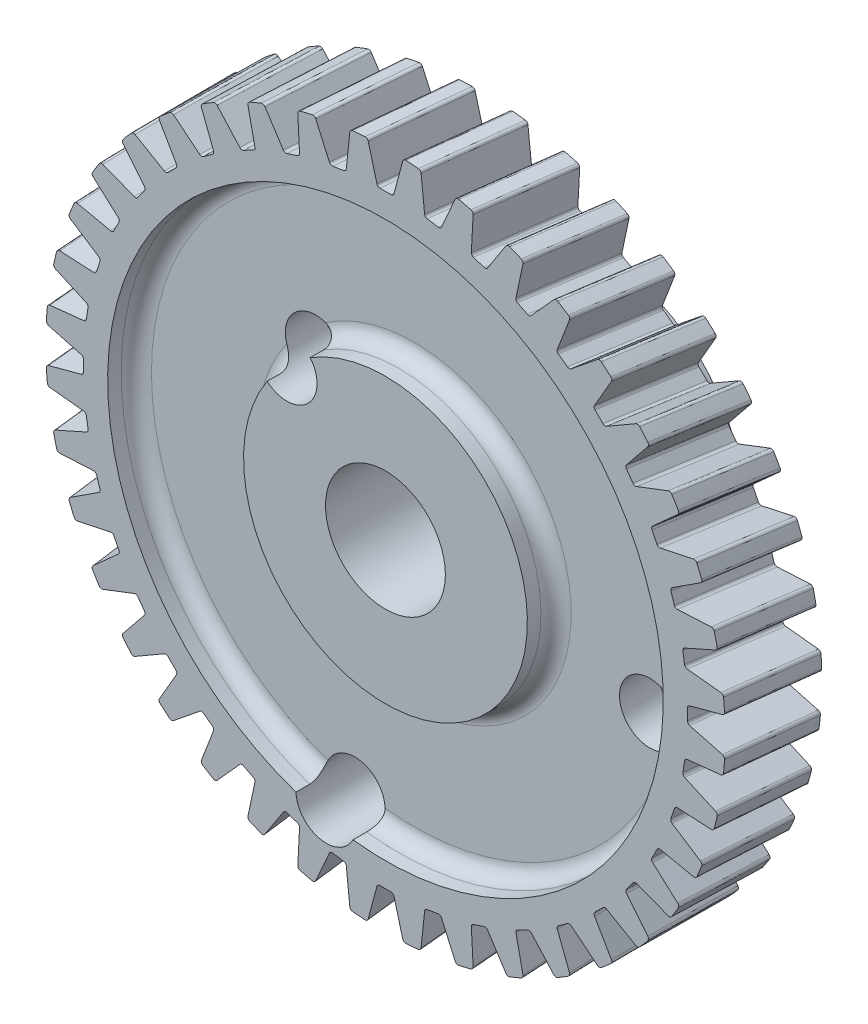
from build123d import *

# Parameters (mm, degrees)
FILLET1_R                = 1
CIRPATTERN1_COUNT        = 40
FILLET2_R                = 0.2
F_4_0_4_DIAMETER_HOLE1_D = 4


with BuildPart() as part:
    # Sketch2 → Revolve1 (revolve)
    with BuildSketch(Plane(origin=(0, 0, 0), x_dir=(0, 0, -1), z_dir=(1, 0, 0))):
        Polygon((11, 3.96875), (-3.2, 3.96875), (-3.2, 9.4), (-1.3, 9.4), (-1.3, 18.4), (-3.2, 18.4), (-3.2, 22.5), (3.2, 22.5), (3.2, 18.4), (1.3, 18.4), (1.3, 9.4), (3.2, 9.4), (11, 9.4), align=None)
    revolve(axis=Axis((0, 0, 0), (0, 0, -1)))

    # Fillet1
    fillet1_edges = [part.edges().sort_by_distance(p)[0] for p in [
        (0, -18.4, 1.3),
        (0, -9.4, 1.3),
        (0, -9.4, -1.3),
        (0, -18.4, -1.3),
    ]]
    fillet(fillet1_edges, radius=FILLET1_R)

    # Cut-Sweep1: sweep along a path in Sketch4
    with BuildLine(Plane(origin=(0, 0, 0), x_dir=(1, 0, 0), z_dir=(0, 1, 0))) as cut_sweep1_path:
        Line((0, -3.2), (0.690971205, 3.2))
    # Sketch3 → Cut-Sweep1 (sweep, cut)
    with BuildSketch(Plane.XY.offset(3.2)):
        Polygon((-0.525, 20), (0.525, 20), (1.246362285, 22.6921607), (-1.246362285, 22.6921607), align=None)
    cut_sweep1 = sweep(path=cut_sweep1_path.line, mode=Mode.SUBTRACT)

    # CirPattern1: Cut-Sweep1 ×40 about axis
    cirpattern1_axis = Axis((0, 0, 3.2), (0, 0, 1))
    for i in range(1, CIRPATTERN1_COUNT):
        add(cut_sweep1.rotate(cirpattern1_axis, i * 360 / CIRPATTERN1_COUNT), mode=Mode.SUBTRACT)

    # Fillet2
    fillet2_edges = [part.edges().sort_by_distance(p)[0] for p in [
        (1.526462518, 22.448160552, 5.3054e-05),
        (0.870485603, 20, 0),
        (-0.845126217, 22.484122435, -6.2808e-05),
        (-2.003996756, 22.410577793, 5.3054e-05),
        (-2.26892082, 19.889940761, 0),
        (-3.305993578, 19.725684573, 0),
        (-4.352012976, 22.07509871, -6.2808e-05),
        (-5.485110979, 21.821172231, 5.3054e-05),
        (-5.352458883, 19.29012517, 0),
        (-6.351068225, 18.965657326, 0),
        (-7.751738732, 21.122512792, -6.2808e-05),
        (-8.831163565, 20.694456989, 5.3054e-05),
        (-8.304201644, 18.215322678, 0),
        (-9.239758494, 17.738632653, 0),
        (-10.960590953, 19.649820507, -6.2808e-05),
        (-11.959763596, 19.058175535, 5.3054e-05),
        (-11.0514674, 16.691998487, 0),
        (-11.900935244, 16.074823972, 0),
        (-13.89955705, 17.693284427, -6.2808e-05),
        (-14.793874554, 16.952618549, 5.3054e-05),
        (-13.526609351, 14.757661896, 0),
        (-14.269071471, 14.015199776, 0),
        (-16.496269922, 15.301080964, -6.2808e-05),
        (-17.263711223, 14.429631832, 5.3054e-05),
        (-15.668681288, 12.459942692, 0),
        (-16.285855803, 11.610474848, 0),
        (-18.68678988, 12.532114106, -6.2808e-05),
        (-19.308458027, 11.55133969, 5.3054e-05),
        (-17.42493829, 9.855418346, 0),
        (-17.901628315, 8.919861496, 0),
        (-20.417179054, 9.454565008, -6.2808e-05),
        (-20.877766513, 8.388615227, 5.3054e-05),
        (-18.752135481, 7.008220892, 0),
        (-19.076603325, 6.00961155, 0),
        (-21.644829518, 6.144213141, -6.2808e-05),
        (-21.932995098, 5.019335218, 5.3054e-05),
        (-19.617592862, 3.988457781, 0),
        (-19.781849051, 2.951385024, 0),
        (-22.339512445, 2.682570354, -6.2808e-05),
        (-22.448160552, 1.526462518, 5.3054e-05),
        (-20, 0.870485603, 0),
        (-20, -0.179514397, 0),
        (-22.484122435, -0.845126217, -6.2808e-05),
        (-22.410577793, -2.003996756, 5.3054e-05),
        (-19.889940761, -2.26892082, 0),
        (-19.725684573, -3.305993578, 0),
        (-22.07509871, -4.352012976, -6.2808e-05),
        (-21.821172231, -5.485110979, 5.3054e-05),
        (-19.29012517, -5.352458883, 0),
        (-18.965657326, -6.351068225, 0),
        (-21.122512792, -7.751738732, -6.2808e-05),
        (-20.694456989, -8.831163565, 5.3054e-05),
        (-18.215322678, -8.304201644, 0),
        (-17.738632653, -9.239758494, 0),
        (-19.649820507, -10.960590953, -6.2808e-05),
        (-19.058175535, -11.959763596, 5.3054e-05),
        (-16.691998487, -11.0514674, 0),
        (-16.074823972, -11.900935244, 0),
        (-17.693284427, -13.89955705, -6.2808e-05),
        (-16.952618549, -14.793874554, 5.3054e-05),
        (-14.757661896, -13.526609351, 0),
        (-14.015199776, -14.269071471, 0),
        (-15.301080964, -16.496269922, -6.2808e-05),
        (-14.429631832, -17.263711223, 5.3054e-05),
        (-12.459942692, -15.668681288, 0),
        (-11.610474848, -16.285855803, 0),
        (-12.532114106, -18.68678988, -6.2808e-05),
        (-11.55133969, -19.308458027, 5.3054e-05),
        (-9.855418346, -17.42493829, 0),
        (-8.919861496, -17.901628315, 0),
        (-9.454565008, -20.417179054, -6.2808e-05),
        (-8.388615227, -20.877766513, 5.3054e-05),
        (-7.008220892, -18.752135481, 0),
        (-6.00961155, -19.076603325, 0),
        (-6.144213141, -21.644829518, -6.2808e-05),
        (-5.019335218, -21.932995098, 5.3054e-05),
        (-3.988457781, -19.617592862, 0),
        (-2.951385024, -19.781849051, 0),
        (-2.682570354, -22.339512445, -6.2808e-05),
        (-1.526462518, -22.448160552, 5.3054e-05),
        (-0.870485603, -20, 0),
        (0.179514397, -20, 0),
        (0.845126217, -22.484122435, -6.2808e-05),
        (2.003996756, -22.410577793, 5.3054e-05),
        (2.26892082, -19.889940761, 0),
        (3.305993578, -19.725684573, 0),
        (4.352012976, -22.07509871, -6.2808e-05),
        (5.485110979, -21.821172231, 5.3054e-05),
        (5.352458883, -19.29012517, 0),
        (6.351068225, -18.965657326, 0),
        (7.751738732, -21.122512792, -6.2808e-05),
        (8.831163565, -20.694456989, 5.3054e-05),
        (8.304201644, -18.215322678, 0),
        (9.239758494, -17.738632653, 0),
        (10.960590953, -19.649820507, -6.2808e-05),
        (11.959763596, -19.058175535, 5.3054e-05),
        (11.0514674, -16.691998487, 0),
        (11.900935244, -16.074823972, 0),
        (13.89955705, -17.693284427, -6.2808e-05),
        (14.793874554, -16.952618549, 5.3054e-05),
        (13.526609351, -14.757661896, 0),
        (14.269071471, -14.015199776, 0),
        (16.496269922, -15.301080964, -6.2808e-05),
        (17.263711223, -14.429631832, 5.3054e-05),
        (15.668681288, -12.459942692, 0),
        (16.285855803, -11.610474848, 0),
        (18.68678988, -12.532114106, -6.2808e-05),
        (19.308458027, -11.55133969, 5.3054e-05),
        (17.42493829, -9.855418346, 0),
        (17.901628315, -8.919861496, 0),
        (20.417179054, -9.454565008, -6.2808e-05),
        (20.877766513, -8.388615227, 5.3054e-05),
        (18.752135481, -7.008220892, 0),
        (19.076603325, -6.00961155, 0),
        (21.644829518, -6.144213141, -6.2808e-05),
        (21.932995098, -5.019335218, 5.3054e-05),
        (19.617592862, -3.988457781, 0),
        (19.781849051, -2.951385024, 0),
        (22.339512445, -2.682570354, -6.2808e-05),
        (22.448160552, -1.526462518, 5.3054e-05),
        (20, -0.870485603, 0),
        (20, 0.179514397, 0),
        (22.484122435, 0.845126217, -6.2808e-05),
        (22.410577793, 2.003996756, 5.3054e-05),
        (19.889940761, 2.26892082, 0),
        (19.725684573, 3.305993578, 0),
        (22.07509871, 4.352012976, -6.2808e-05),
        (21.821172231, 5.485110979, 5.3054e-05),
        (19.29012517, 5.352458883, 0),
        (18.965657326, 6.351068225, 0),
        (21.122512792, 7.751738732, -6.2808e-05),
        (20.694456989, 8.831163565, 5.3054e-05),
        (18.215322678, 8.304201644, 0),
        (17.738632653, 9.239758494, 0),
        (19.649820507, 10.960590953, -6.2808e-05),
        (19.058175535, 11.959763596, 5.3054e-05),
        (16.691998487, 11.0514674, 0),
        (16.074823972, 11.900935244, 0),
        (17.693284427, 13.89955705, -6.2808e-05),
        (16.952618549, 14.793874554, 5.3054e-05),
        (14.757661896, 13.526609351, 0),
        (14.015199776, 14.269071471, 0),
        (15.301080964, 16.496269922, -6.2808e-05),
        (14.429631832, 17.263711223, 5.3054e-05),
        (12.459942692, 15.668681288, 0),
        (11.610474848, 16.285855803, 0),
        (12.532114106, 18.68678988, -6.2808e-05),
        (11.55133969, 19.308458027, 5.3054e-05),
        (9.855418346, 17.42493829, 0),
        (8.919861496, 17.901628315, 0),
        (9.454565008, 20.417179054, -6.2808e-05),
        (8.388615227, 20.877766513, 5.3054e-05),
        (7.008220892, 18.752135481, 0),
        (6.00961155, 19.076603325, 0),
        (6.144213141, 21.644829518, -6.2808e-05),
        (5.019335218, 21.932995098, 5.3054e-05),
        (3.988457781, 19.617592862, 0),
        (2.951385024, 19.781849051, 0),
        (2.682570354, 22.339512445, -6.2808e-05),
        (-0.179514397, 20, 0),
    ]]
    fillet(fillet2_edges, radius=FILLET2_R)

    # Ø4.0 (4) Diameter Hole1 (through all)
    with Locations(Plane(origin=(66.617802584, -178.239954308, 3.9366), x_dir=(0.9999854958897523, -0.005385908477352911, 0), z_dir=(0, 0, 1))):
        with Locations((-74.142612517, 184.544143989), (-51.957233868, 174.890807578), (-71.409957755, 160.504374281)):
            Hole(F_4_0_4_DIAMETER_HOLE1_D / 2)


solid = part.part
